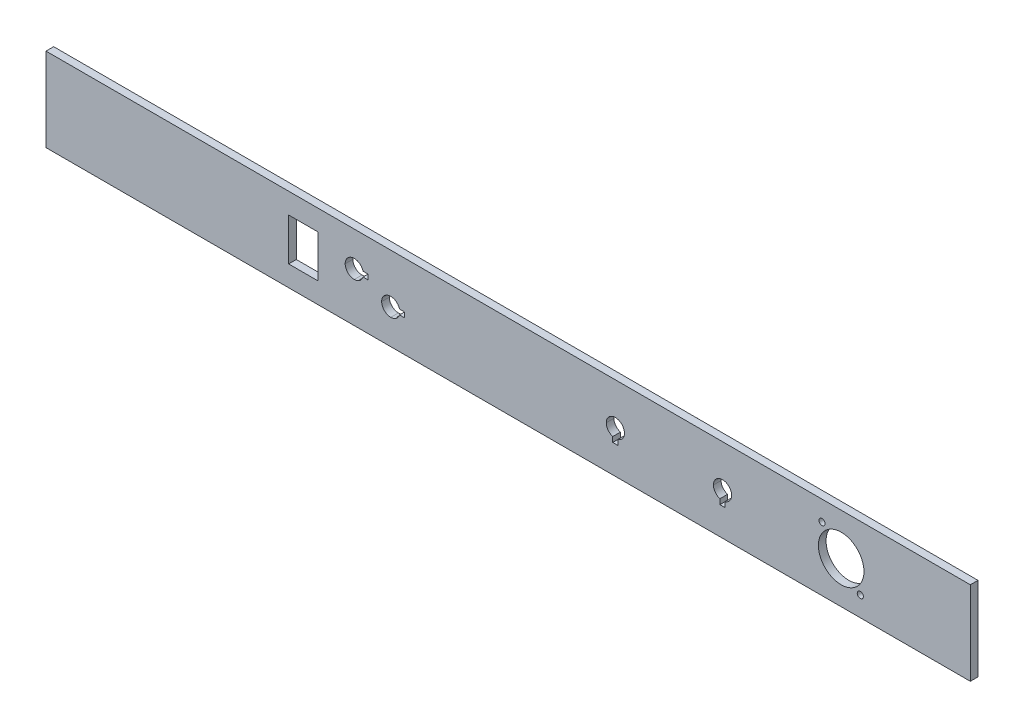
from build123d import *

# Parameters (mm, degrees)
SKETCH1_W           = 483
SKETCH1_H           = 43.7
BOSS_EXTRUDE1_DEPTH = 4
SKETCH2_R           = 11.9
SKETCH2_R_2         = 1.6
SKETCH2_W           = 15.419852382
SKETCH2_H           = 22.139786355
CUT_EXTRUDE1_DEPTH  = 4


with BuildPart() as part:
    # Sketch1 → Boss-Extrude1 (new body)
    with BuildSketch(Plane.XY):
        Rectangle(SKETCH1_W, SKETCH1_H)
    extrude(amount=BOSS_EXTRUDE1_DEPTH)

    # Sketch2 → Cut-Extrude1 (cut)
    with BuildSketch(Plane.XY.offset(4)):
        with Locations((173.993165462, 0)):
            Circle(SKETCH2_R)
        with Locations((183.993165462, -11.5)):
            Circle(SKETCH2_R_2)
        with Locations((163.993165462, 11.5)):
            Circle(SKETCH2_R_2)
        with Locations((-106.998126785, 0.004549598)):
            Rectangle(SKETCH2_W, SKETCH2_H)
        with BuildLine():
            Line((110.634956288, -7.311215886), (113.277465434, -7.311215886))
            Line((113.277465434, -7.311215886), (113.277465434, -4.659409192))
            add(Edge.make_bspline(
                [(113.277465434, -4.659409192), (115.28093114, -4.102835429), (116.757388152, -2.262363819), (116.757388152, -0.081560848)],
                knots=[0, 0, 0, 0, 1, 1, 1, 1], degree=3))
            add(Edge.make_bspline(
                [(116.757388152, -0.081560848), (116.757388152, 2.540418575), (114.634039351, 4.66376029), (112.012038669, 4.66376029)],
                knots=[0, 0, 0, 0, 1, 1, 1, 1], degree=3))
            add(Edge.make_bspline(
                [(112.012038669, 4.66376029), (109.390045073, 4.66376029), (107.25738455, 2.540418575), (107.25738455, -0.081560848)],
                knots=[0, 0, 0, 0, 1, 1, 1, 1], degree=3))
            add(Edge.make_bspline(
                [(107.25738455, -0.081560848), (107.25738455, -2.225336618), (108.683566063, -4.041873419), (110.634956288, -4.631495288)],
                knots=[0, 0, 0, 0, 1, 1, 1, 1], degree=3))
            Line((110.634956288, -4.631495288), (110.634956288, -7.311215886))
        make_face()
        with BuildLine():
            Line((54.634987856, -7.178454325), (57.277497002, -7.178454325))
            Line((57.277497002, -7.178454325), (57.277497002, -4.526647632))
            add(Edge.make_bspline(
                [(57.277497002, -4.526647632), (59.280962708, -3.970073868), (60.757419721, -2.129602259), (60.757419721, 0.051200713)],
                knots=[0, 0, 0, 0, 1, 1, 1, 1], degree=3))
            add(Edge.make_bspline(
                [(60.757419721, 0.051200713), (60.757419721, 2.673180136), (58.634070919, 4.79652185), (56.012070237, 4.79652185)],
                knots=[0, 0, 0, 0, 1, 1, 1, 1], degree=3))
            add(Edge.make_bspline(
                [(56.012070237, 4.79652185), (53.390076641, 4.79652185), (51.257416119, 2.673180136), (51.257416119, 0.051200713)],
                knots=[0, 0, 0, 0, 1, 1, 1, 1], degree=3))
            add(Edge.make_bspline(
                [(51.257416119, 0.051200713), (51.257416119, -2.092575057), (52.683597632, -3.909111858), (54.634987856, -4.498733728)],
                knots=[0, 0, 0, 0, 1, 1, 1, 1], degree=3))
            Line((54.634987856, -4.498733728), (54.634987856, -7.178454325))
        make_face()
        with BuildLine():
            Line((-75.863032724, 2.437431633), (-73.183312126, 2.437431633))
            Line((-73.183312126, 2.437431633), (-73.183312126, 5.079940778))
            Line((-73.183312126, 5.079940778), (-75.835122364, 5.079940778))
            add(Edge.make_bspline(
                [(-75.835122364, 5.079940778), (-76.391696127, 7.083406485), (-78.232164193, 8.559863497), (-80.412967165, 8.559863497)],
                knots=[0, 0, 0, 0, 1, 1, 1, 1], degree=3))
            add(Edge.make_bspline(
                [(-80.412967165, 8.559863497), (-83.034946587, 8.559863497), (-85.158291846, 6.436514696), (-85.158291846, 3.814514013)],
                knots=[0, 0, 0, 0, 1, 1, 1, 1], degree=3))
            add(Edge.make_bspline(
                [(-85.158291846, 3.814514013), (-85.158291846, 1.192520417), (-83.034946587, -0.940136562), (-80.412967165, -0.940136562)],
                knots=[0, 0, 0, 0, 1, 1, 1, 1], degree=3))
            add(Edge.make_bspline(
                [(-80.412967165, -0.940136562), (-78.269191395, -0.940136562), (-76.452654594, 0.486044951), (-75.863032724, 2.437431633)],
                knots=[0, 0, 0, 0, 1, 1, 1, 1], degree=3))
        make_face()
        with BuildLine():
            Line((-56.813217733, -5.182493655), (-54.133497135, -5.182493655))
            Line((-54.133497135, -5.182493655), (-54.133497135, -2.539984509))
            Line((-54.133497135, -2.539984509), (-56.785303829, -2.539984509))
            add(Edge.make_bspline(
                [(-56.785303829, -2.539984509), (-57.341877592, -0.536518803), (-59.182349202, 0.939938209), (-61.363152173, 0.939938209)],
                knots=[0, 0, 0, 0, 1, 1, 1, 1], degree=3))
            add(Edge.make_bspline(
                [(-61.363152173, 0.939938209), (-63.985131596, 0.939938209), (-66.108473311, -1.183410592), (-66.108473311, -3.805411275)],
                knots=[0, 0, 0, 0, 1, 1, 1, 1], degree=3))
            add(Edge.make_bspline(
                [(-66.108473311, -3.805411275), (-66.108473311, -6.427404871), (-63.985131596, -8.560065393), (-61.363152173, -8.560065393)],
                knots=[0, 0, 0, 0, 1, 1, 1, 1], degree=3))
            add(Edge.make_bspline(
                [(-61.363152173, -8.560065393), (-59.219376404, -8.560065393), (-57.402839602, -7.13388388), (-56.813217733, -5.182493655)],
                knots=[0, 0, 0, 0, 1, 1, 1, 1], degree=3))
        make_face()
    extrude(amount=-CUT_EXTRUDE1_DEPTH, mode=Mode.SUBTRACT)


solid = part.part
